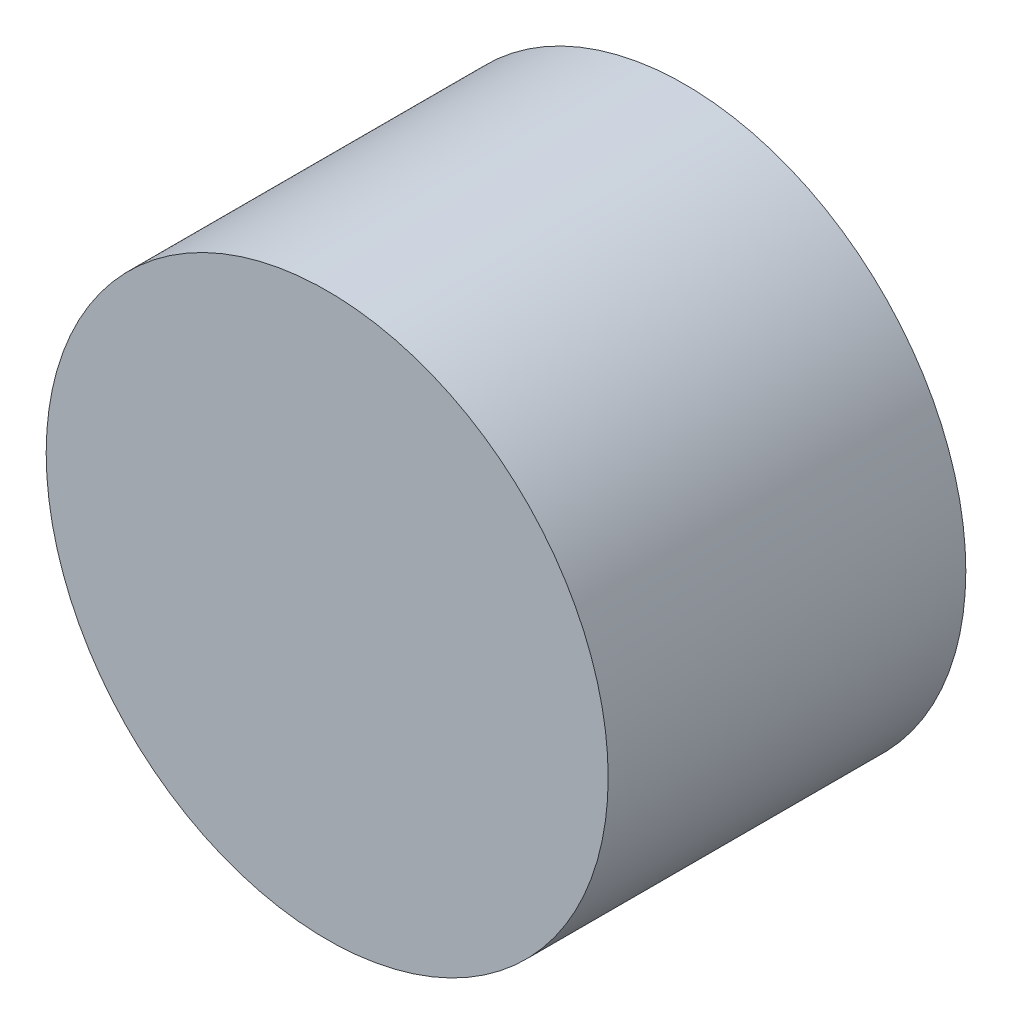
from build123d import *

# Parameters (mm, degrees)
SKETCH1_R           = 1.397
BOSS_EXTRUDE1_DEPTH = 0.889


with BuildPart() as part:
    # Sketch1 → Boss-Extrude1 (new, symmetric)
    with BuildSketch(Plane.XY):
        Circle(SKETCH1_R)
    extrude(amount=BOSS_EXTRUDE1_DEPTH, both=True)


solid = part.part
